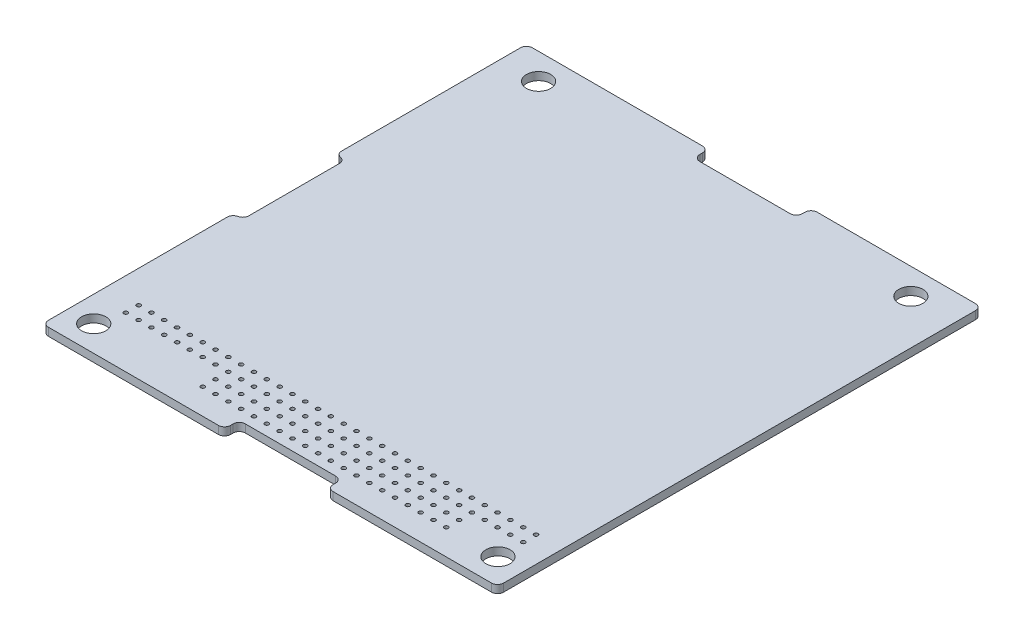
from build123d import *

# Parameters (mm, degrees)
SKETCH1_W           = 90.17
SKETCH1_H           = 95.89
BOSS_EXTRUDE1_DEPTH = 1.57
SKETCH2_W           = 20.32
SKETCH2_H           = 2.93
SKETCH2_W_2         = 1.92
SKETCH2_H_2         = 20.27
SKETCH2_H_3         = 2.92
CUT_EXTRUDE1_DEPTH  = 1.57
SKETCH3_R           = 2.4
CUT_EXTRUDE2_DEPTH  = 1.57
FILLET7_R           = 1.2
FILLET8_R           = 1.2
FILLET9_R           = 1.2
FILLET10_R          = 1.2
FILLET11_R          = 1.2
FILLET12_R          = 1.2
FILLET13_R          = 1.2
FILLET14_R          = 1.2
FILLET17_R          = 1.2
FILLET18_R          = 1.2
FILLET19_R          = 1.2
FILLET20_R          = 1.2
FILLET21_R          = 1.2
SKETCH11_R          = 0.4
CUT_EXTRUDE8_DEPTH  = 10
SKETCH12_R          = 0.4
CUT_EXTRUDE9_DEPTH  = 10
SKETCH13_R          = 0.4
CUT_EXTRUDE10_DEPTH = 10
SKETCH14_R          = 0.4
CUT_EXTRUDE11_DEPTH = 10


with BuildPart() as part:
    # Sketch1 → Boss-Extrude1 (new body)
    with BuildSketch(Plane(origin=(0, 0, 0), x_dir=(1, 0, 0), z_dir=(0, 1, 0))):
        Rectangle(SKETCH1_W, SKETCH1_H)
    extrude(amount=BOSS_EXTRUDE1_DEPTH)

    # Sketch2 → Cut-Extrude1 (cut)
    with BuildSketch(Plane(origin=(0, 1.57, 0), x_dir=(1, 0, 0), z_dir=(0, 1, 0))):
        with Locations((1.145, 46.48)):
            Rectangle(SKETCH2_W, SKETCH2_H)
        with Locations((-44.125, 0)):
            Rectangle(SKETCH2_W_2, SKETCH2_H_2)
        with Locations((1.145, -46.485)):
            Rectangle(SKETCH2_W, SKETCH2_H_3)
    extrude(amount=-CUT_EXTRUDE1_DEPTH, mode=Mode.SUBTRACT)

    # Sketch3 → Cut-Extrude2 (cut)
    with BuildSketch(Plane(origin=(0, 1.57, 0), x_dir=(1, 0, 0), z_dir=(0, 1, 0))):
        with Locations((-40.005, -42.865)):
            Circle(SKETCH3_R)
        with Locations((40.005, -42.785)):
            Circle(SKETCH3_R)
        with Locations((-37.515, 42.785)):
            Circle(SKETCH3_R)
        with Locations((36.235, 42.785)):
            Circle(SKETCH3_R)
    extrude(amount=-CUT_EXTRUDE2_DEPTH, mode=Mode.SUBTRACT)

    # Fillet7
    fillet7_edges = [part.edges().sort_by_distance(p)[0] for p in [
        (-9.015, 0.785, 45.025),
    ]]
    fillet(fillet7_edges, radius=FILLET7_R)

    # Fillet8
    fillet8_edges = [part.edges().sort_by_distance(p)[0] for p in [
        (-9.015, 0.785, 47.945),
    ]]
    fillet(fillet8_edges, radius=FILLET8_R)

    # Fillet9
    fillet9_edges = [part.edges().sort_by_distance(p)[0] for p in [
        (11.305, 0.785, 47.945),
        (11.305, 0.785, 45.025),
    ]]
    fillet(fillet9_edges, radius=FILLET9_R)

    # Fillet10
    fillet10_edges = [part.edges().sort_by_distance(p)[0] for p in [
        (45.085, 0.785, 47.945),
    ]]
    fillet(fillet10_edges, radius=FILLET10_R)

    # Fillet11
    fillet11_edges = [part.edges().sort_by_distance(p)[0] for p in [
        (45.085, 0.785, -47.945),
    ]]
    fillet(fillet11_edges, radius=FILLET11_R)

    # Fillet12
    fillet12_edges = [part.edges().sort_by_distance(p)[0] for p in [
        (11.305, 0.785, -45.015),
        (11.305, 0.785, -47.945),
    ]]
    fillet(fillet12_edges, radius=FILLET12_R)

    # Fillet13
    fillet13_edges = [part.edges().sort_by_distance(p)[0] for p in [
        (-9.015, 0.785, -47.945),
        (-9.015, 0.785, -45.015),
    ]]
    fillet(fillet13_edges, radius=FILLET13_R)

    # Fillet14
    fillet14_edges = [part.edges().sort_by_distance(p)[0] for p in [
        (-45.085, 0.785, -47.945),
    ]]
    fillet(fillet14_edges, radius=FILLET14_R)

    # Fillet17
    fillet17_edges = [part.edges().sort_by_distance(p)[0] for p in [
        (-45.085, 0.785, -10.135),
    ]]
    fillet(fillet17_edges, radius=FILLET17_R)

    # Fillet18
    fillet18_edges = [part.edges().sort_by_distance(p)[0] for p in [
        (-43.165, 0.785, -10.135),
    ]]
    fillet(fillet18_edges, radius=FILLET18_R)

    # Fillet19
    fillet19_edges = [part.edges().sort_by_distance(p)[0] for p in [
        (-45.085, 0.785, 10.135),
    ]]
    fillet(fillet19_edges, radius=FILLET19_R)

    # Fillet20
    fillet20_edges = [part.edges().sort_by_distance(p)[0] for p in [
        (-43.165, 0.785, 10.135),
    ]]
    fillet(fillet20_edges, radius=FILLET20_R)

    # Fillet21
    fillet21_edges = [part.edges().sort_by_distance(p)[0] for p in [
        (-45.085, 0.785, 47.945),
    ]]
    fillet(fillet21_edges, radius=FILLET21_R)

    # Sketch11 → Cut-Extrude8 (cut)
    with BuildSketch(Plane(origin=(0, 1.57, 0), x_dir=(1, 0, 0), z_dir=(0, 1, 0))):
        with Locations((-38.735, -37.785)):
            Circle(SKETCH11_R)
        with Locations((-36.195, -37.785)):
            Circle(SKETCH11_R)
        with Locations((-33.655, -37.785)):
            Circle(SKETCH11_R)
        with Locations((-31.115, -37.785)):
            Circle(SKETCH11_R)
        with Locations((-28.575, -37.785)):
            Circle(SKETCH11_R)
        with Locations((-26.035, -37.785)):
            Circle(SKETCH11_R)
        with Locations((-23.495, -37.785)):
            Circle(SKETCH11_R)
        with Locations((-20.955, -37.785)):
            Circle(SKETCH11_R)
        with Locations((-18.415, -37.785)):
            Circle(SKETCH11_R)
        with Locations((-15.875, -37.785)):
            Circle(SKETCH11_R)
        with Locations((-13.335, -37.785)):
            Circle(SKETCH11_R)
        with Locations((-10.795, -37.785)):
            Circle(SKETCH11_R)
        with Locations((-8.255, -37.785)):
            Circle(SKETCH11_R)
        with Locations((-5.715, -37.785)):
            Circle(SKETCH11_R)
        with Locations((-3.175, -37.785)):
            Circle(SKETCH11_R)
        with Locations((-0.635, -37.785)):
            Circle(SKETCH11_R)
        with Locations((1.905, -37.785)):
            Circle(SKETCH11_R)
        with Locations((4.445, -37.785)):
            Circle(SKETCH11_R)
        with Locations((6.985, -37.785)):
            Circle(SKETCH11_R)
        with Locations((9.525, -37.785)):
            Circle(SKETCH11_R)
        with Locations((12.065, -37.785)):
            Circle(SKETCH11_R)
        with Locations((14.605, -37.785)):
            Circle(SKETCH11_R)
        with Locations((17.145, -37.785)):
            Circle(SKETCH11_R)
        with Locations((19.685, -37.785)):
            Circle(SKETCH11_R)
        with Locations((22.225, -37.785)):
            Circle(SKETCH11_R)
        with Locations((24.765, -37.785)):
            Circle(SKETCH11_R)
        with Locations((27.305, -37.785)):
            Circle(SKETCH11_R)
        with Locations((29.845, -37.785)):
            Circle(SKETCH11_R)
        with Locations((32.385, -37.785)):
            Circle(SKETCH11_R)
        with Locations((34.925, -37.785)):
            Circle(SKETCH11_R)
        with Locations((37.465, -37.785)):
            Circle(SKETCH11_R)
        with Locations((40.005, -37.785)):
            Circle(SKETCH11_R)
    extrude(amount=-CUT_EXTRUDE8_DEPTH, mode=Mode.SUBTRACT)

    # Sketch12 → Cut-Extrude9 (cut)
    with BuildSketch(Plane(origin=(0, 1.57, 0), x_dir=(1, 0, 0), z_dir=(0, 1, 0))):
        with Locations((-38.735, -35.245)):
            Circle(SKETCH12_R)
        with Locations((-36.195, -35.245)):
            Circle(SKETCH12_R)
        with Locations((-33.655, -35.245)):
            Circle(SKETCH12_R)
        with Locations((-31.115, -35.245)):
            Circle(SKETCH12_R)
        with Locations((-28.575, -35.245)):
            Circle(SKETCH12_R)
        with Locations((-26.035, -35.245)):
            Circle(SKETCH12_R)
        with Locations((-23.495, -35.245)):
            Circle(SKETCH12_R)
        with Locations((-20.955, -35.245)):
            Circle(SKETCH12_R)
        with Locations((-18.415, -35.245)):
            Circle(SKETCH12_R)
        with Locations((-15.875, -35.245)):
            Circle(SKETCH12_R)
        with Locations((-13.335, -35.245)):
            Circle(SKETCH12_R)
        with Locations((-10.795, -35.245)):
            Circle(SKETCH12_R)
        with Locations((-8.255, -35.245)):
            Circle(SKETCH12_R)
        with Locations((-5.715, -35.245)):
            Circle(SKETCH12_R)
        with Locations((-3.175, -35.245)):
            Circle(SKETCH12_R)
        with Locations((-0.635, -35.245)):
            Circle(SKETCH12_R)
        with Locations((1.905, -35.245)):
            Circle(SKETCH12_R)
        with Locations((4.445, -35.245)):
            Circle(SKETCH12_R)
        with Locations((6.985, -35.245)):
            Circle(SKETCH12_R)
        with Locations((9.525, -35.245)):
            Circle(SKETCH12_R)
        with Locations((12.065, -35.245)):
            Circle(SKETCH12_R)
        with Locations((14.605, -35.245)):
            Circle(SKETCH12_R)
        with Locations((17.145, -35.245)):
            Circle(SKETCH12_R)
        with Locations((19.685, -35.245)):
            Circle(SKETCH12_R)
        with Locations((22.225, -35.245)):
            Circle(SKETCH12_R)
        with Locations((24.765, -35.245)):
            Circle(SKETCH12_R)
        with Locations((27.305, -35.245)):
            Circle(SKETCH12_R)
        with Locations((29.845, -35.245)):
            Circle(SKETCH12_R)
        with Locations((32.385, -35.245)):
            Circle(SKETCH12_R)
        with Locations((34.925, -35.245)):
            Circle(SKETCH12_R)
        with Locations((37.465, -35.245)):
            Circle(SKETCH12_R)
        with Locations((40.005, -35.245)):
            Circle(SKETCH12_R)
    extrude(amount=-CUT_EXTRUDE9_DEPTH, mode=Mode.SUBTRACT)

    # Sketch13 → Cut-Extrude10 (cut)
    with BuildSketch(Plane(origin=(0, 1.57, 0), x_dir=(1, 0, 0), z_dir=(0, 1, 0))):
        with Locations((-18.415, -42.865)):
            Circle(SKETCH13_R)
        with Locations((-15.875, -42.865)):
            Circle(SKETCH13_R)
        with Locations((-13.335, -42.865)):
            Circle(SKETCH13_R)
        with Locations((-10.795, -42.865)):
            Circle(SKETCH13_R)
        with Locations((-8.255, -42.865)):
            Circle(SKETCH13_R)
        with Locations((-5.715, -42.865)):
            Circle(SKETCH13_R)
        with Locations((-3.175, -42.865)):
            Circle(SKETCH13_R)
        with Locations((-0.635, -42.865)):
            Circle(SKETCH13_R)
        with Locations((1.905, -42.865)):
            Circle(SKETCH13_R)
        with Locations((4.445, -42.865)):
            Circle(SKETCH13_R)
        with Locations((6.985, -42.865)):
            Circle(SKETCH13_R)
        with Locations((9.525, -42.865)):
            Circle(SKETCH13_R)
        with Locations((12.065, -42.865)):
            Circle(SKETCH13_R)
        with Locations((14.605, -42.865)):
            Circle(SKETCH13_R)
        with Locations((17.145, -42.865)):
            Circle(SKETCH13_R)
        with Locations((19.685, -42.865)):
            Circle(SKETCH13_R)
        with Locations((22.225, -42.865)):
            Circle(SKETCH13_R)
        with Locations((24.765, -42.865)):
            Circle(SKETCH13_R)
        with Locations((27.305, -42.865)):
            Circle(SKETCH13_R)
        with Locations((29.845, -42.865)):
            Circle(SKETCH13_R)
    extrude(amount=-CUT_EXTRUDE10_DEPTH, mode=Mode.SUBTRACT)

    # Sketch14 → Cut-Extrude11 (cut)
    with BuildSketch(Plane(origin=(0, 1.57, 0), x_dir=(1, 0, 0), z_dir=(0, 1, 0))):
        with Locations((-18.415, -40.325)):
            Circle(SKETCH14_R)
        with Locations((-15.875, -40.325)):
            Circle(SKETCH14_R)
        with Locations((-13.335, -40.325)):
            Circle(SKETCH14_R)
        with Locations((-10.795, -40.325)):
            Circle(SKETCH14_R)
        with Locations((-8.255, -40.325)):
            Circle(SKETCH14_R)
        with Locations((-5.715, -40.325)):
            Circle(SKETCH14_R)
        with Locations((-3.175, -40.325)):
            Circle(SKETCH14_R)
        with Locations((-0.635, -40.325)):
            Circle(SKETCH14_R)
        with Locations((1.905, -40.325)):
            Circle(SKETCH14_R)
        with Locations((4.445, -40.325)):
            Circle(SKETCH14_R)
        with Locations((6.985, -40.325)):
            Circle(SKETCH14_R)
        with Locations((9.525, -40.325)):
            Circle(SKETCH14_R)
        with Locations((12.065, -40.325)):
            Circle(SKETCH14_R)
        with Locations((14.605, -40.325)):
            Circle(SKETCH14_R)
        with Locations((17.145, -40.325)):
            Circle(SKETCH14_R)
        with Locations((19.685, -40.325)):
            Circle(SKETCH14_R)
        with Locations((22.225, -40.325)):
            Circle(SKETCH14_R)
        with Locations((24.765, -40.325)):
            Circle(SKETCH14_R)
        with Locations((27.305, -40.325)):
            Circle(SKETCH14_R)
        with Locations((29.845, -40.325)):
            Circle(SKETCH14_R)
    extrude(amount=-CUT_EXTRUDE11_DEPTH, mode=Mode.SUBTRACT)


solid = part.part
